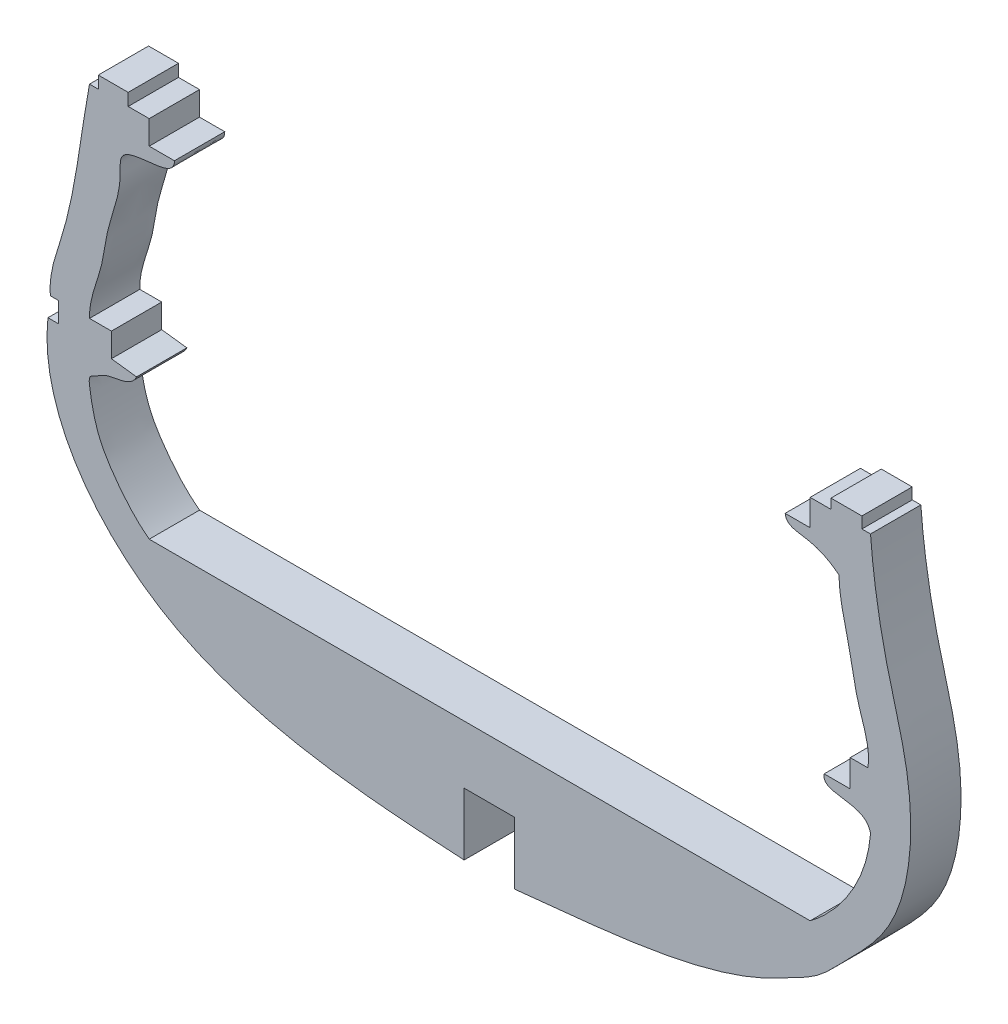
from build123d import *

# Parameters (mm, degrees)
EXTRUDE_1_DEPTH = 8


with BuildPart() as part:
    # 草图1 → 凸台-拉伸1 (new body)
    with BuildSketch(Plane.XY):
        with BuildLine():
            Line((466.610421995, 742.217465611), (571.690475164, 742.217465611))
            add(Edge.make_bspline(
                [(571.690475164, 742.217465611), (576.965570063, 746.18457554), (580.795338365, 752.379762708), (581.290753085, 759.032482634)],
                knots=[0, 0, 0, 0, 1, 1, 1, 1], degree=3))
            add(Edge.make_bspline(
                [(581.290753085, 759.032482634), (580.798252783, 761.218018447), (577.385615988, 761.480933972), (573.686124809, 762.232747143), (573.918780111, 763.559910027)],
                knots=[0, 0, 0, 0, 0.647423509, 1, 1, 1, 1], degree=3))
            Line((573.918780111, 763.559910027), (578.061223905, 763.559910027))
            Line((578.061223905, 763.559910027), (578.061223905, 767.868581887))
            Line((578.061223905, 767.868581887), (580.857107616, 767.868581887))
            add(Edge.make_bspline(
                [(580.857107616, 767.868581887), (581.35998239, 770.847210578), (579.141476728, 775.393519205), (577.974982245, 783.577636415), (576.329614654, 788.706000483), (576.259173128, 792.147148403)],
                knots=[0, 0, 0, 0, 0.352752785, 0.588696291, 1, 1, 1, 1], degree=3))
            add(Edge.make_bspline(
                [(567.71443016, 796.329661046), (567.882472851, 794.862039946), (571.963415817, 794.66942952), (574.493758071, 793.516560279), (576.259173128, 792.147148403)],
                knots=[0, 0, 0, 0, 0.387326309, 1, 1, 1, 1], degree=3))
            Line((567.71443016, 796.329661046), (571.690475164, 796.329661046))
            Line((571.690475164, 796.329661046), (571.690475164, 800.519357468))
            Line((571.690475164, 800.519357468), (575.000858719, 800.519357468))
            Line((575.000858719, 800.519357468), (575.000858719, 802.071259174))
            Line((575.000858719, 802.071259174), (579.919545447, 802.071259174))
            Line((579.919545447, 802.071259174), (579.919545447, 800.277413034))
            Line((579.919545447, 800.277413034), (581.290753085, 800.277413034))
            add(Edge.make_bspline(
                [(581.290753085, 800.277413034), (581.75257878, 794.155087196), (583.333001525, 784.670773475), (587.358410051, 771.289033003), (588.224220647, 759.303355108), (584.956521497, 746.823889545), (577.941941002, 740.270839096), (572.910681534, 734.948565725), (568.596293073, 732.856869181), (562.806439248, 729.755319339), (548.546525498, 725.069649566), (534.885077537, 724.188919985), (524.682032522, 723.07522479)],
                knots=[0, 0, 0, 0, 0.152614723, 0.238179542, 0.346667134, 0.448688985, 0.545213484, 0.580364516, 0.629911252, 0.66261385, 0.743993344, 1, 1, 1, 1], degree=3))
            Line((524.682032522, 723.07522479), (524.682032522, 732.234136994))
            Line((524.682032522, 732.234136994), (524.682032522, 732.97522479))
            Line((524.682032522, 732.97522479), (516.681014441, 732.97522479))
            Line((516.681014441, 732.97522479), (516.681014441, 732.234136994))
            Line((516.681014441, 732.234136994), (516.681014441, 723.07522479))
            add(Edge.make_bspline(
                [(516.681014441, 723.07522479), (506.324680358, 723.653865979), (489.670526392, 724.717002102), (462.060067562, 734.295878378), (449.088902304, 751.801659624), (450.510165567, 764.663045908)],
                knots=[0, 0, 0, 0, 0.358876997, 0.569204983, 1, 1, 1, 1], degree=3))
            Line((450.510165567, 764.663045908), (452.168569125, 764.663045908))
            Line((452.168569125, 764.663045908), (452.168569125, 767.868581887))
            Line((452.168569125, 767.868581887), (450.90028316, 767.868581887))
            add(Edge.make_bspline(
                [(450.90028316, 767.868581887), (450.618571468, 771.052815296), (454.751033891, 781.306374186), (455.663155267, 792.405683568), (457.114884389, 800.124858449)],
                knots=[0, 0, 0, 0, 0.279320488, 1, 1, 1, 1], degree=3))
            Line((457.114884389, 800.124858449), (458.509998951, 800.124858449))
            Line((458.509998951, 800.124858449), (458.509998951, 802.071259174))
            Line((458.509998951, 802.071259174), (463.26607132, 802.071259174))
            Line((463.26607132, 802.071259174), (463.26607132, 800.124858449))
            Line((463.26607132, 800.124858449), (466.610421995, 800.124858449))
            Line((466.610421995, 800.124858449), (466.610421995, 796.329661046))
            Line((466.610421995, 796.329661046), (470.622129918, 796.329661046))
            add(Edge.make_bspline(
                [(457.114884389, 767.868581887), (457.046442193, 770.850710278), (459.057596274, 774.76839207), (459.641070061, 780.11255623), (460.888809205, 784.68435213), (462.257979608, 788.497181653), (461.562781841, 795.506593649), (470.706965804, 793.102535826), (470.622129918, 796.329661046)],
                knots=[0, 0, 0, 0, 0.254341408, 0.369747983, 0.46600371, 0.663215063, 0.735184517, 1, 1, 1, 1], degree=3))
            Line((457.114884389, 767.868581887), (460.602670793, 767.868581887))
            Line((460.602670793, 767.868581887), (460.602670793, 764.061080621))
            Line((460.602670793, 764.061080621), (464.597771583, 763.559910027))
            add(Edge.make_bspline(
                [(458.906217535, 760.901172904), (460.623386282, 762.074985719), (463.551374388, 761.285868403), (464.597771583, 763.559910027)],
                knots=[0, 0, 0, 0, 1, 1, 1, 1], degree=3))
            add(Edge.make_bspline(
                [(466.610421995, 742.217465611), (464.277007499, 743.929127729), (459.793441561, 749.506987279), (457.870925706, 753.470688528), (456.84467266, 760.238713286), (457.705964101, 760.116567471), (458.906217535, 760.901172904)],
                knots=[0, 0, 0, 0, 0.369244443, 0.820134238, 0.903851561, 1, 1, 1, 1], degree=3))
        make_face()
    extrude(amount=EXTRUDE_1_DEPTH)


solid = part.part
